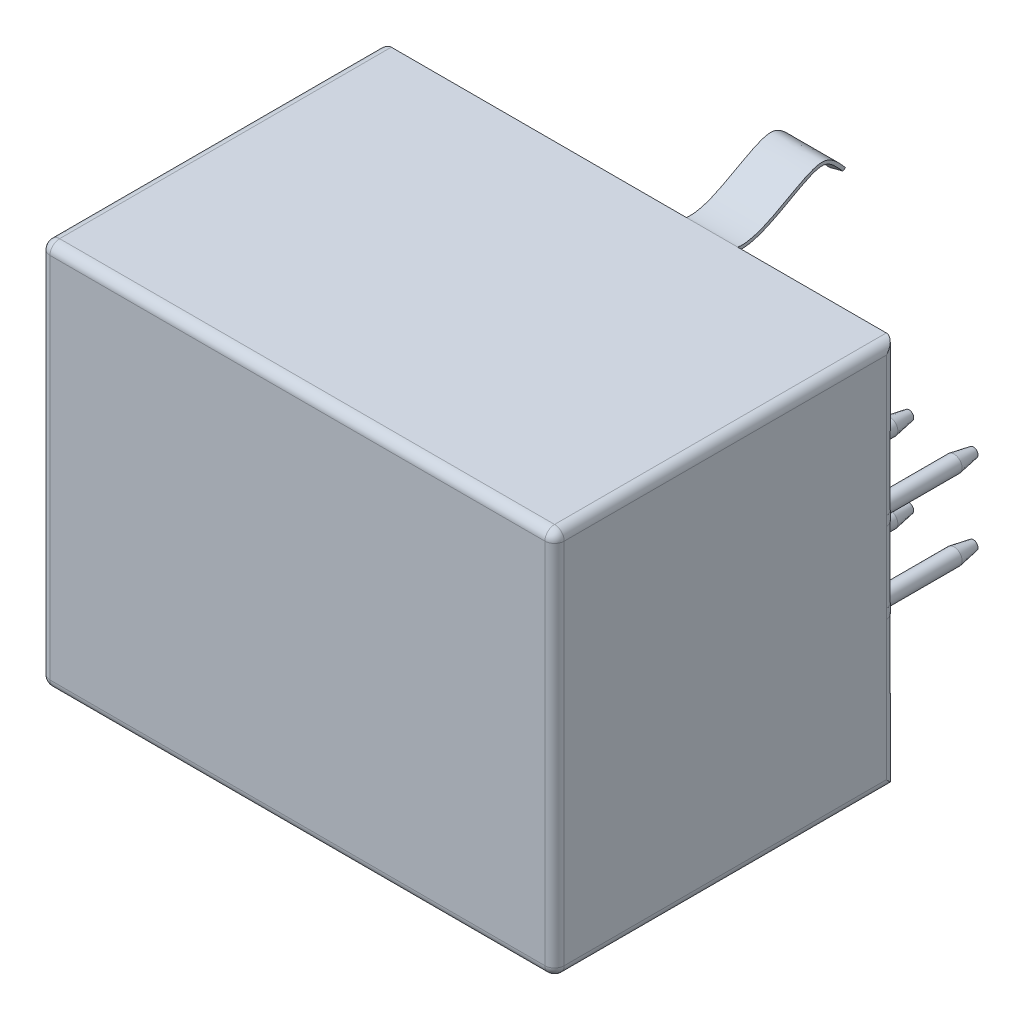
from build123d import *
from OCP.BRepFilletAPI import BRepFilletAPI_MakeChamfer

# Parameters (mm, degrees)
SKETCH1_W                 = 10.62
SKETCH1_H                 = 12.04
BOSS_EXTRUDE1_DEPTH       = 16
CUT_EXTRUDE1_DEPTH        = 9
SKETCH3_W                 = 3
SKETCH3_H                 = 5.5
BOSS_EXTRUDE2_DEPTH       = 9
EXTRUDE_THIN1_DEPTH       = 2
SKETCH5_W                 = 1
SKETCH5_H                 = 2
SKETCH5_W_2               = 1.1
CUT_EXTRUDE2_DEPTH        = 9
SKETCH6_R                 = 0.25
BOSS_EXTRUDE4_DEPTH       = 2.91
CHAMFER1_SIZE             = 0.6
CHAMFER1_SIZE2            = 0.105796188
EXTRUDE_THIN2_START       = -0.8
EXTRUDE_THIN2_DEPTH       = 1.6
CHAMFER2_SIZE             = 0.6
CHAMFER2_SIZE2            = 0.767964979
CHAMFER2_OF_MIRROR2_SIZE  = 0.6
CHAMFER2_OF_MIRROR2_SIZE2 = 0.767964979
CHAMFER3_SIZE             = 0.5
CHAMFER3_SIZE2            = 0.639970816
FILLET1_R                 = 0.3


# Read off the part's stored shape, not the designer's step: Extrude-Thin2
with BuildPart() as part:
    # Sketch1 → Boss-Extrude1 (new body)
    with BuildSketch(Plane(origin=(0, 0, 0), x_dir=(0, 0, -1), z_dir=(1, 0, 0))):
        with Locations((5.31, 6.02)):
            Rectangle(SKETCH1_W, SKETCH1_H)
    extrude(amount=BOSS_EXTRUDE1_DEPTH)

    # Sketch2 → Cut-Extrude1 (cut)
    with BuildSketch(Plane.ZY):
        Polygon((-3.461320344, 10.245), (-1.34, 8.123679656), (-1.34, 3.916320344), (-3.461320344, 1.795), (-9.12, 1.795), (-9.12, 10.245), align=None)
    extrude(amount=-CUT_EXTRUDE1_DEPTH, mode=Mode.SUBTRACT)

    # Sketch3 → Boss-Extrude2 (add)
    with BuildSketch(Plane.ZY.offset(-9)):
        with Locations((-5.32, 6.02)):
            Rectangle(SKETCH3_W, SKETCH3_H)
    extrude(amount=BOSS_EXTRUDE2_DEPTH)

    # Sketch4 → Extrude-Thin1 (add, symmetric)
    with BuildSketch(Plane(origin=(0, 6.02, 0), x_dir=(1, 0, 0), z_dir=(0, 1, 0))):
        with BuildLine():
            ThreePointArc((1.854248689, 3.82), (4.5, 2.82), (7.145751311, 3.82))
            Line((7.145751311, 3.82), (7.211895094, 3.745))
            ThreePointArc((7.211895094, 3.745), (4.5, 2.72), (1.788104906, 3.745))
            Line((1.788104906, 3.745), (1.854248689, 3.82))
        make_face()
        with BuildLine():
            ThreePointArc((1.854248689, 6.82), (4.5, 7.82), (7.145751311, 6.82))
            Line((7.145751311, 6.82), (7.079607528, 6.745))
            ThreePointArc((7.079607528, 6.745), (4.5, 7.72), (1.920392472, 6.745))
            Line((1.920392472, 6.745), (1.854248689, 6.82))
        make_face()
    extrude(amount=EXTRUDE_THIN1_DEPTH, both=True)


with BuildPart() as extrude_thin1_piece_1:
    # of the separate pieces the step leaves, piece 1, a body of its own (extrude_thin1_pieces)
    add(part.part.solids().sort_by_distance((0, 0, 0))[0])


with BuildPart() as extrude_thin1_piece_2:
    # of the separate pieces the step leaves, piece 2, a body of its own (extrude_thin1_pieces)
    add(part.part.solids().sort_by_distance((1.788104906, 4.02, -3.745))[0])


with BuildPart() as cut_extrude2_tool:
    # Sketch5 → Cut-Extrude2 (new body)
    with BuildSketch(Plane.ZY):
        with Locations((-7.32, 6.02)):
            Rectangle(SKETCH5_W, SKETCH5_H)
        with Locations((-3.27, 6.02)):
            Rectangle(SKETCH5_W_2, SKETCH5_H)
    extrude(amount=-CUT_EXTRUDE2_DEPTH)


with BuildPart() as extrude_thin1_piece_1_1:
    add(extrude_thin1_piece_1.part)

    # Cut-Extrude2: cut by cut_extrude2_tool
    add(cut_extrude2_tool.part, mode=Mode.SUBTRACT)

    # Sketch6 → Boss-Extrude4 (add)
    with BuildSketch(Plane(origin=(0, 0, -10.62), x_dir=(-1, 0, 0), z_dir=(0, 0, -1))):
        with Locations(Location((-15.5, 4.77, 0), (0, 0, 180))):
            Circle(SKETCH6_R)
        with Locations(Location((-13.5, 4.77, 0), (0, 0, 180))):
            Circle(SKETCH6_R)
    boss_extrude4 = extrude(amount=BOSS_EXTRUDE4_DEPTH)

    # Mirror1: Boss-Extrude4 across plane
    add(boss_extrude4.mirror(Plane.ZX.offset(6.02)))

    # Chamfer1: one chamfer whose edges measure the first distance from different faces: ONE call of the kernel's chamfer builder (chamfer() names one face for all edges)
    chamfer1_edges_1 = [extrude_thin1_piece_1_1.edges().sort_by_distance(p)[0] for p in [
        (15.25, 4.77, -13.53),
    ]]
    chamfer1_side_1 = [extrude_thin1_piece_1_1.faces().sort_by_distance(p)[0] for p in [
        (15.25, 4.77, -12.075),
    ]]
    chamfer1_edges_2 = [extrude_thin1_piece_1_1.edges().sort_by_distance(p)[0] for p in [
        (13.25, 4.77, -13.53),
    ]]
    chamfer1_side_2 = [extrude_thin1_piece_1_1.faces().sort_by_distance(p)[0] for p in [
        (13.25, 4.77, -12.075),
    ]]
    chamfer1_edges_3 = [extrude_thin1_piece_1_1.edges().sort_by_distance(p)[0] for p in [
        (15.25, 7.27, -13.53),
    ]]
    chamfer1_side_3 = [extrude_thin1_piece_1_1.faces().sort_by_distance(p)[0] for p in [
        (15.25, 7.27, -12.075),
    ]]
    chamfer1_edges_4 = [extrude_thin1_piece_1_1.edges().sort_by_distance(p)[0] for p in [
        (13.25, 7.27, -13.53),
    ]]
    chamfer1_side_4 = [extrude_thin1_piece_1_1.faces().sort_by_distance(p)[0] for p in [
        (13.25, 7.27, -12.075),
    ]]
    chamfer1 = BRepFilletAPI_MakeChamfer(extrude_thin1_piece_1_1.part.solid().wrapped)
    for e in chamfer1_edges_1:
        chamfer1.Add(CHAMFER1_SIZE, CHAMFER1_SIZE2, e.wrapped, chamfer1_side_1[0].wrapped)  # the first distance lies on this face
    for e in chamfer1_edges_2:
        chamfer1.Add(CHAMFER1_SIZE, CHAMFER1_SIZE2, e.wrapped, chamfer1_side_2[0].wrapped)  # the first distance lies on this face
    for e in chamfer1_edges_3:
        chamfer1.Add(CHAMFER1_SIZE, CHAMFER1_SIZE2, e.wrapped, chamfer1_side_3[0].wrapped)  # the first distance lies on this face
    for e in chamfer1_edges_4:
        chamfer1.Add(CHAMFER1_SIZE, CHAMFER1_SIZE2, e.wrapped, chamfer1_side_4[0].wrapped)  # the first distance lies on this face
    add(Compound.cast(chamfer1.Shape()), mode=Mode.REPLACE)

    # Extrude-Thin2 outline → Extrude-Thin2 (add)
    with BuildSketch(Plane(origin=(10.28, 0, 0), x_dir=(0, 0, -1), z_dir=(1, 0, 0)).offset(EXTRUDE_THIN2_START)):
        with BuildLine():
            add(Edge.make_bspline(
                [(10.62, 0.100785264), (10.78746189, 0.120691448), (10.961308674, 0.097575512), (11.31686022, 0.000462287), (11.499294447, -0.075182032), (12.042092662, -0.336079557), (12.399243383, -0.555911401), (12.854919353, -0.78062608), (12.993528767, -0.837606718), (13.220692587, -0.889968812), (13.303177575, -0.888038744), (13.490975312, -0.810678223), (13.599756729, -0.728624571), (13.87736205, -0.434805978), (14.045169288, -0.224974114), (14.260148158, 0.060197038)],
                knots=[0.00319215, 0.00319215, 0.00319215, 0.00319215, 0.125, 0.125, 0.25, 0.25, 0.5, 0.5, 0.625, 0.625, 0.75, 0.75, 0.875, 0.875, 1, 1, 1, 1], degree=3))
            Line((10.62, 0.100785264), (10.62, 0))
            add(Edge.make_bspline(
                [(10.62, 0), (11.386548613, 0.101703811), (13.086621384, -1.362502031), (13.690445345, -0.861639328), (14.34, 0)],
                knots=[0, 0, 0, 0, 0.62378462, 1, 1, 1, 1], degree=3))
            Line((14.34, 0), (14.260148158, 0.060197038))
        make_face()
    extrude_thin2 = extrude(amount=EXTRUDE_THIN2_DEPTH)

    # Chamfer2: one chamfer whose edges measure the first distance from different faces: ONE call of the kernel's chamfer builder (chamfer() names one face for all edges)
    chamfer2_edges_1 = [extrude_thin1_piece_1_1.edges().sort_by_distance(p)[0] for p in [
        (9.48, 0.030098519, -14.300074079),
    ]]
    chamfer2_side_1 = [extrude_thin1_piece_1_1.faces().sort_by_distance(p)[0] for p in [
        (9.48, -0.678712297, -12.564688228),
    ]]
    chamfer2_edges_2 = [extrude_thin1_piece_1_1.edges().sort_by_distance(p)[0] for p in [
        (11.08, 0.030098519, -14.300074079),
    ]]
    chamfer2_side_2 = [extrude_thin1_piece_1_1.faces().sort_by_distance(p)[0] for p in [
        (11.08, -0.678712297, -12.564688228),
    ]]
    chamfer2 = BRepFilletAPI_MakeChamfer(extrude_thin1_piece_1_1.part.solid().wrapped)
    for e in chamfer2_edges_1:
        chamfer2.Add(CHAMFER2_SIZE, CHAMFER2_SIZE2, e.wrapped, chamfer2_side_1[0].wrapped)  # the first distance lies on this face
    for e in chamfer2_edges_2:
        chamfer2.Add(CHAMFER2_SIZE, CHAMFER2_SIZE2, e.wrapped, chamfer2_side_2[0].wrapped)  # the first distance lies on this face
    add(Compound.cast(chamfer2.Shape()), mode=Mode.REPLACE)

    # Mirror2: Extrude-Thin2 across plane
    add(extrude_thin2.mirror(Plane.ZX.offset(6.02)))

    # Chamfer2 of Mirror2: one chamfer whose edges measure the first distance from different faces: ONE call of the kernel's chamfer builder (chamfer() names one face for all edges)
    chamfer2_of_mirror2_edges_1 = [extrude_thin1_piece_1_1.edges().sort_by_distance(p)[0] for p in [
        (9.48, 12.009901481, -14.300074079),
    ]]
    chamfer2_of_mirror2_side_1 = [extrude_thin1_piece_1_1.faces().sort_by_distance(p)[0] for p in [
        (9.48, 12.718712297, -12.564688228),
    ]]
    chamfer2_of_mirror2_edges_2 = [extrude_thin1_piece_1_1.edges().sort_by_distance(p)[0] for p in [
        (11.08, 12.009901481, -14.300074079),
    ]]
    chamfer2_of_mirror2_side_2 = [extrude_thin1_piece_1_1.faces().sort_by_distance(p)[0] for p in [
        (11.08, 12.718712297, -12.564688228),
    ]]
    chamfer2_of_mirror2 = BRepFilletAPI_MakeChamfer(extrude_thin1_piece_1_1.part.solid().wrapped)
    for e in chamfer2_of_mirror2_edges_1:
        chamfer2_of_mirror2.Add(CHAMFER2_OF_MIRROR2_SIZE, CHAMFER2_OF_MIRROR2_SIZE2, e.wrapped, chamfer2_of_mirror2_side_1[0].wrapped)  # the first distance lies on this face
    for e in chamfer2_of_mirror2_edges_2:
        chamfer2_of_mirror2.Add(CHAMFER2_OF_MIRROR2_SIZE, CHAMFER2_OF_MIRROR2_SIZE2, e.wrapped, chamfer2_of_mirror2_side_2[0].wrapped)  # the first distance lies on this face
    add(Compound.cast(chamfer2_of_mirror2.Shape()), mode=Mode.REPLACE)

    # Chamfer3: one chamfer whose edges measure the first distance from different faces: ONE call of the kernel's chamfer builder (chamfer() names one face for all edges)
    chamfer3_edges_1 = [extrude_thin1_piece_1_1.edges().sort_by_distance(p)[0] for p in [
        (0, 2.855660172, -2.400660172),
        (0, 6.02, -1.34),
        (0, 9.184339828, -2.400660172),
        (0, 10.245, -6.290660172),
        (0, 6.02, -9.12),
        (0, 1.795, -6.290660172),
    ]]
    chamfer3_side_1 = [extrude_thin1_piece_1_1.faces().sort_by_distance(p)[0] for p in [
        (0, 0.160544698, -5.31),
    ]]
    chamfer3_edges_2 = [extrude_thin1_piece_1_1.edges().sort_by_distance(p)[0] for p in [
        (0, 6.02, -6.82),
    ]]
    chamfer3_side_2 = [extrude_thin1_piece_1_1.faces().sort_by_distance(p)[0] for p in [
        (4.5, 6.02, -6.82),
    ]]
    chamfer3_edges_3 = [extrude_thin1_piece_1_1.edges().sort_by_distance(p)[0] for p in [
        (0, 3.27, -5.32),
    ]]
    chamfer3_side_3 = [extrude_thin1_piece_1_1.faces().sort_by_distance(p)[0] for p in [
        (4.5, 3.27, -5.32),
    ]]
    chamfer3_edges_4 = [extrude_thin1_piece_1_1.edges().sort_by_distance(p)[0] for p in [
        (0, 6.02, -3.82),
    ]]
    chamfer3_side_4 = [extrude_thin1_piece_1_1.faces().sort_by_distance(p)[0] for p in [
        (4.5, 6.02, -3.82),
    ]]
    chamfer3_edges_5 = [extrude_thin1_piece_1_1.edges().sort_by_distance(p)[0] for p in [
        (0, 8.77, -5.32),
    ]]
    chamfer3_side_5 = [extrude_thin1_piece_1_1.faces().sort_by_distance(p)[0] for p in [
        (4.5, 8.77, -5.32),
    ]]
    chamfer3 = BRepFilletAPI_MakeChamfer(extrude_thin1_piece_1_1.part.solid().wrapped)
    for e in chamfer3_edges_1:
        chamfer3.Add(CHAMFER3_SIZE, CHAMFER3_SIZE2, e.wrapped, chamfer3_side_1[0].wrapped)  # the first distance lies on this face
    for e in chamfer3_edges_2:
        chamfer3.Add(CHAMFER3_SIZE, CHAMFER3_SIZE2, e.wrapped, chamfer3_side_2[0].wrapped)  # the first distance lies on this face
    for e in chamfer3_edges_3:
        chamfer3.Add(CHAMFER3_SIZE, CHAMFER3_SIZE2, e.wrapped, chamfer3_side_3[0].wrapped)  # the first distance lies on this face
    for e in chamfer3_edges_4:
        chamfer3.Add(CHAMFER3_SIZE, CHAMFER3_SIZE2, e.wrapped, chamfer3_side_4[0].wrapped)  # the first distance lies on this face
    for e in chamfer3_edges_5:
        chamfer3.Add(CHAMFER3_SIZE, CHAMFER3_SIZE2, e.wrapped, chamfer3_side_5[0].wrapped)  # the first distance lies on this face
    add(Compound.cast(chamfer3.Shape()), mode=Mode.REPLACE)

    # Fillet1
    fillet1_edges = [extrude_thin1_piece_1_1.edges().sort_by_distance(p)[0] for p in [
        (16, 6.02, -10.62),
        (16, 12.04, -5.31),
        (16, 6.02, 0),
        (0, 12.04, -5.31),
        (0, 6.02, -10.62),
        (0, 0, -5.31),
        (0, 6.02, 0),
        (16, 0, -5.31),
        (8, 12.04, 0),
        (8, 0, 0),
    ]]
    fillet(fillet1_edges, radius=FILLET1_R)


with BuildPart() as extrude_thin1_piece_2_1:
    add(extrude_thin1_piece_2.part)

    # Cut-Extrude2: cut by cut_extrude2_tool
    add(cut_extrude2_tool.part, mode=Mode.SUBTRACT)


solid = Compound([extrude_thin1_piece_1_1.part, extrude_thin1_piece_2_1.part])
